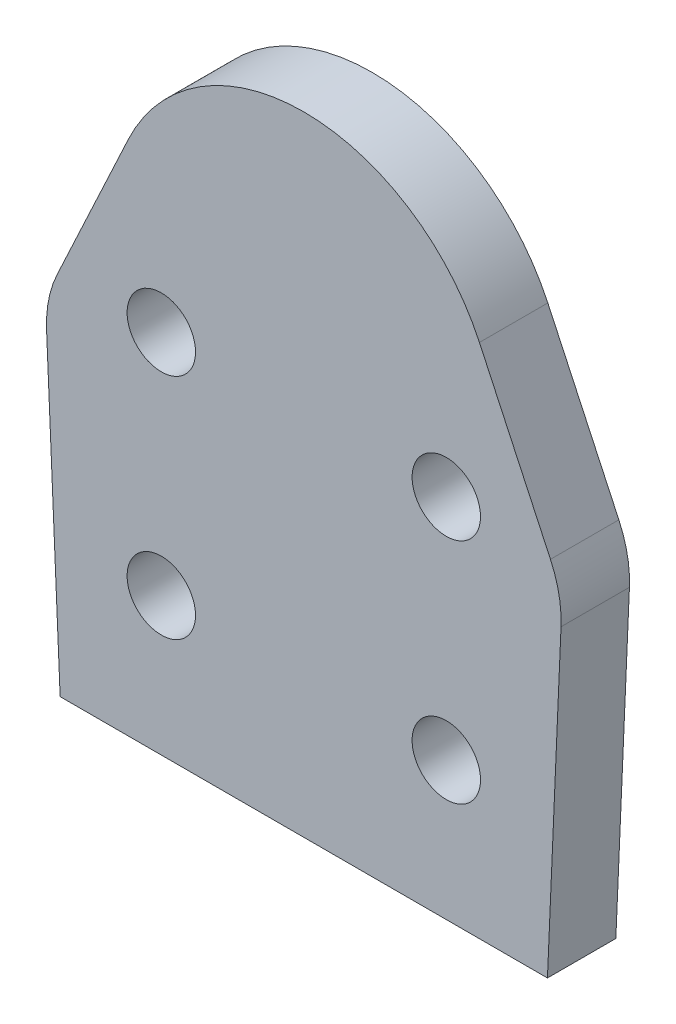
from build123d import *

# Parameters (mm, degrees)
SKETCH1_R           = 1.5
BOSS_EXTRUDE1_DEPTH = 3


with BuildPart() as part:
    # Sketch1 → Boss-Extrude1 (new body)
    with BuildSketch(Plane.XY):
        with BuildLine():
            Line((-11.282357346, 86.580844321), (-10.686866316, 72.941857381))
            Line((-10.686866316, 72.941857381), (10.686866316, 72.941857381))
            Line((10.686866316, 72.941857381), (11.282357346, 86.580844321))
            ThreePointArc((11.282357346, 86.580844321), (11.19104264, 87.774392868), (10.818655174, 88.912032567))
            Line((10.818655174, 88.912032567), (7.70361619, 95.592255225))
            ThreePointArc((7.70361619, 95.592255225), (0, 100.5), (-7.70361619, 95.592255225))
            Line((-7.70361619, 95.592255225), (-10.818655174, 88.912032567))
            ThreePointArc((-10.818655174, 88.912032567), (-11.19104264, 87.774392868), (-11.282357346, 86.580844321))
        make_face()
        with Locations((-6.25, 79)):
            Circle(SKETCH1_R, mode=Mode.SUBTRACT)
        with Locations((-6.25, 89)):
            Circle(SKETCH1_R, mode=Mode.SUBTRACT)
        with Locations((6.25, 79)):
            Circle(SKETCH1_R, mode=Mode.SUBTRACT)
        with Locations((6.25, 89)):
            Circle(SKETCH1_R, mode=Mode.SUBTRACT)
    extrude(amount=BOSS_EXTRUDE1_DEPTH)


solid = part.part
